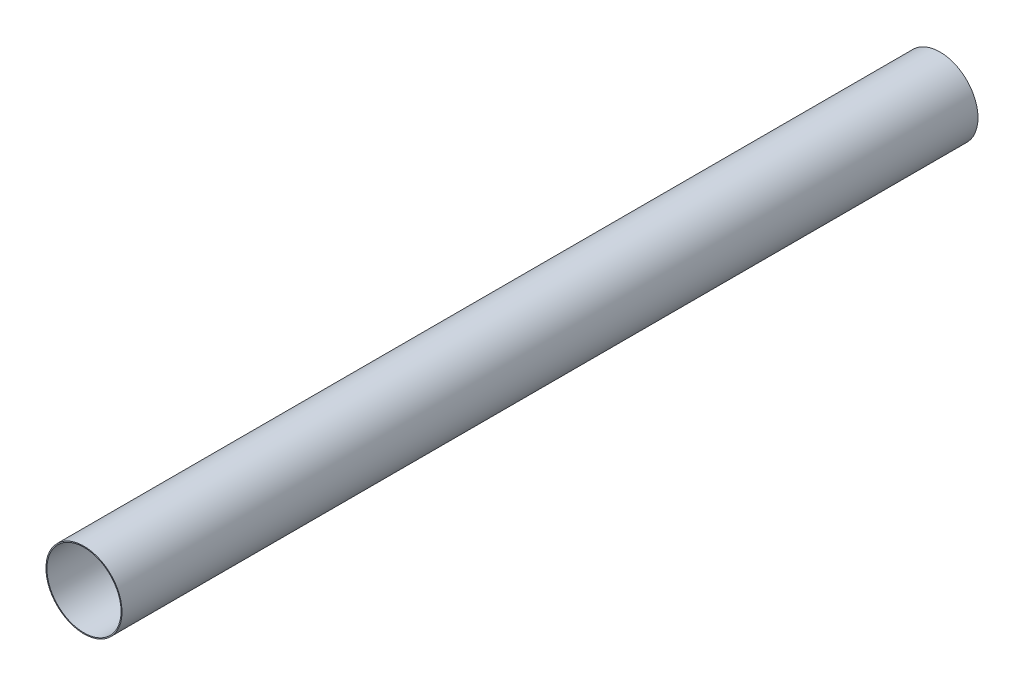
from build123d import *

# Parameters (mm, degrees)
SKETCH1_R           = 78.2
SKETCH1_R_2         = 76.2
BOSS_EXTRUDE1_DEPTH = 1760


with BuildPart() as part:
    # Sketch1 → Boss-Extrude1 (new body)
    with BuildSketch(Plane.XY):
        Circle(SKETCH1_R)
        Circle(SKETCH1_R_2, mode=Mode.SUBTRACT)
    extrude(amount=BOSS_EXTRUDE1_DEPTH)


solid = part.part
